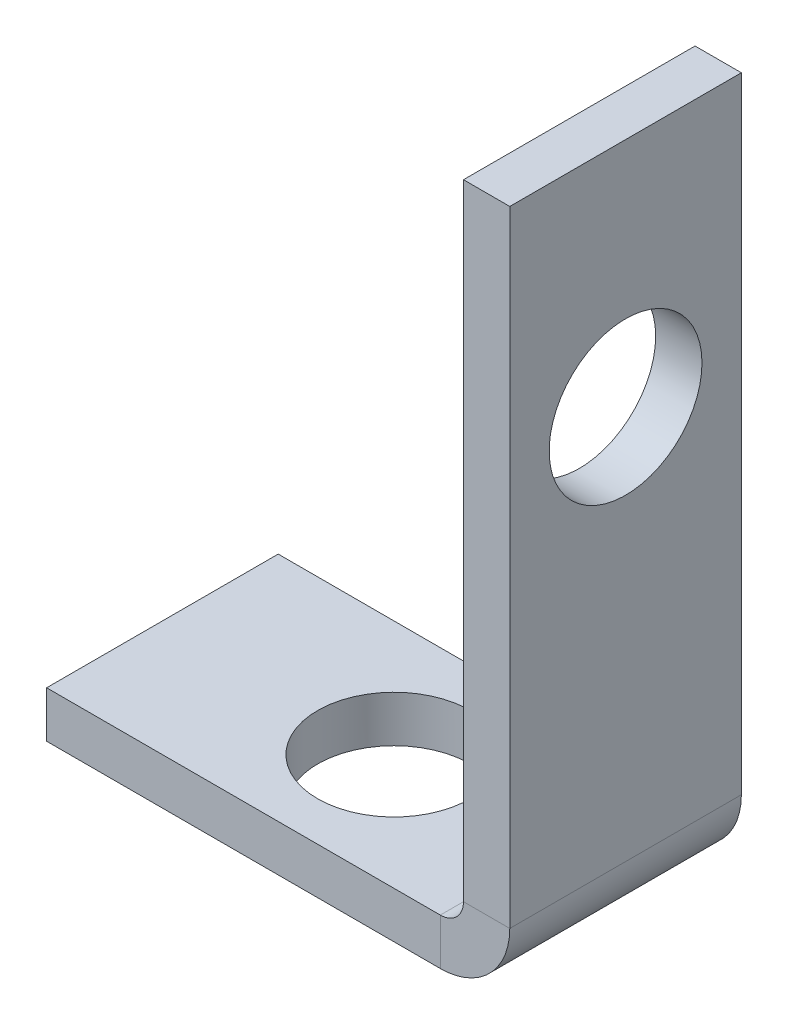
from build123d import *

# Parameters (mm, degrees)
BRIDA_BASE1_DEPTH                          = 5
TALADRO_DE_MARGEN_PARA_M65_D               = 6.6
TALADRO_DE_MARGEN_PARA_M65_DEPTH           = 11.62
TALADRO_DE_MARGEN_PARA_M65_TIP             = 1.982840043
TALADRO_DE_MARGEN_PARA_M65_ON_FACE_2_D     = 6.6
TALADRO_DE_MARGEN_PARA_M65_ON_FACE_2_DEPTH = 11.62
TALADRO_DE_MARGEN_PARA_M65_ON_FACE_2_TIP   = 1.982840043


# Sheet-metal steps are written as plain solids
with BuildPart() as part:
    # Croquis1 → Brida base1 (new, symmetric)
    with BuildSketch(Plane.XY):
        with BuildLine():
            Line((0, 30), (0, 3))
            ThreePointArc((0, 3), (-0.878679656, 0.878679656), (-3, 0))
            Line((-3, 0), (-20, 0))
            Line((-20, 0), (-20, 2))
            Line((-20, 2), (-3, 2))
            ThreePointArc((-3, 2), (-2.292893219, 2.292893219), (-2, 3))
            Line((-2, 3), (-2, 30))
            Line((-2, 30), (0, 30))
        make_face()
    extrude(amount=BRIDA_BASE1_DEPTH, both=True)

    # Taladro de margen para M65
    with Locations(Plane(origin=(0, 20, 0), x_dir=(0, 1, 0), z_dir=(1, 0, 0))):
        with Locations((0, 0)):
            Hole(TALADRO_DE_MARGEN_PARA_M65_D / 2, depth=TALADRO_DE_MARGEN_PARA_M65_DEPTH)
            with Locations((0, 0, -(TALADRO_DE_MARGEN_PARA_M65_DEPTH + TALADRO_DE_MARGEN_PARA_M65_TIP / 2))):  # 118° drill point
                Cone(0, TALADRO_DE_MARGEN_PARA_M65_D / 2, TALADRO_DE_MARGEN_PARA_M65_TIP, mode=Mode.SUBTRACT)

    # Taladro de margen para M65 on face 2
    with Locations(Plane(origin=(-10, 2, 0), x_dir=(0, 0, 1), z_dir=(0, 1, 0))):
        with Locations((0, 0)):
            Hole(TALADRO_DE_MARGEN_PARA_M65_ON_FACE_2_D / 2, depth=TALADRO_DE_MARGEN_PARA_M65_ON_FACE_2_DEPTH)
            with Locations((0, 0, -(TALADRO_DE_MARGEN_PARA_M65_ON_FACE_2_DEPTH + TALADRO_DE_MARGEN_PARA_M65_ON_FACE_2_TIP / 2))):  # 118° drill point
                Cone(0, TALADRO_DE_MARGEN_PARA_M65_ON_FACE_2_D / 2, TALADRO_DE_MARGEN_PARA_M65_ON_FACE_2_TIP, mode=Mode.SUBTRACT)


solid = part.part
